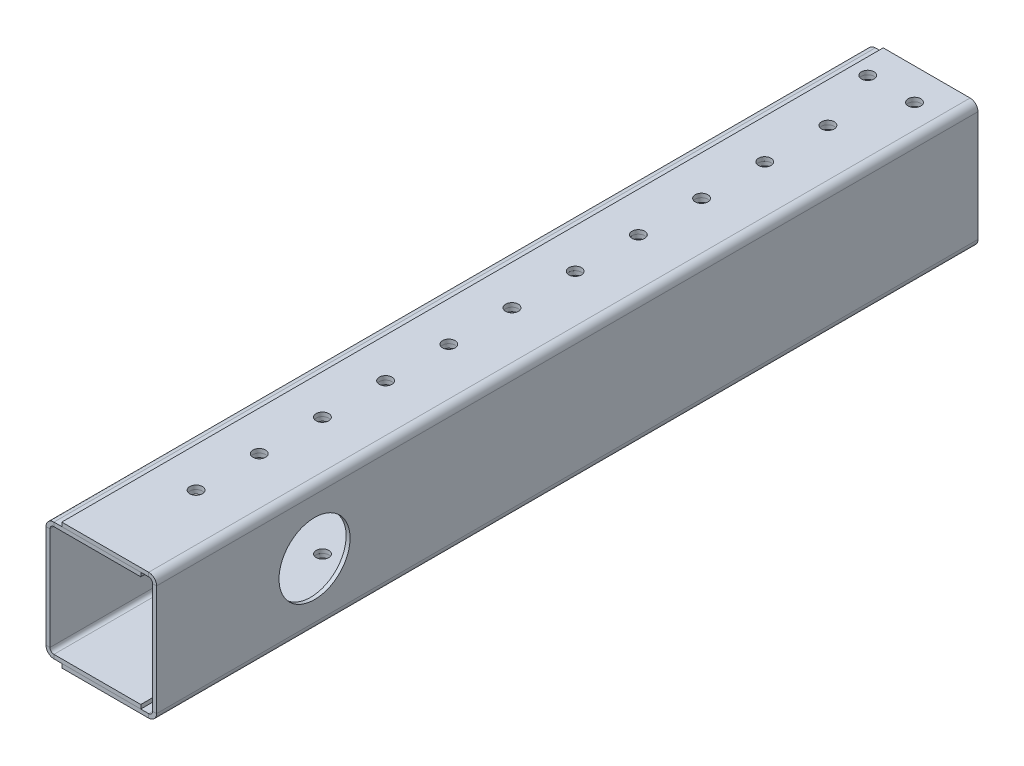
from build123d import *

# Parameters (mm, degrees)
SKETCH1_W                    = 330.2
SKETCH1_H                    = 50.8
SKETCH1_R                    = 14.2875
BOSS_EXTRUDE1_DEPTH          = 1.5875
EDGE_FLANGE1_STRIP_W         = 9.525
EDGE_FLANGE1_STRIP_H         = 1.5875
EDGE_FLANGE1_STRIP_CUT_DEPTH = 330.2
EDGE_FLANGE1_DEPTH           = 330.2
EDGE_FLANGE2_STRIP_W         = 9.525
EDGE_FLANGE2_STRIP_H         = 1.5875
EDGE_FLANGE2_STRIP_CUT_DEPTH = 330.2
EDGE_FLANGE2_DEPTH           = 330.2
SKETCH12_W                   = 330.2
SKETCH12_H                   = 47.625
SKETCH12_R                   = 14.286584365
BOSS_EXTRUDE2_DEPTH          = 1.5875
EDGE_FLANGE3_STRIP_W         = 9.525
EDGE_FLANGE3_STRIP_H         = 1.5875
EDGE_FLANGE3_STRIP_CUT_DEPTH = 330.2
EDGE_FLANGE3_DEPTH           = 330.2
EDGE_FLANGE4_STRIP_W         = 9.525
EDGE_FLANGE4_STRIP_H         = 1.5875
EDGE_FLANGE4_STRIP_CUT_DEPTH = 330.2
EDGE_FLANGE4_DEPTH           = 330.2
SKETCH21_R                   = 2.54
CUT_EXTRUDE1_DEPTH           = 248.894110458
LPATTERN1_COUNT              = 6
LPATTERN1_PITCH              = 25.4
LPATTERN2_COUNT              = 6
LPATTERN2_PITCH              = 25.4
SKETCH27_R                   = 2.54
CUT_EXTRUDE2_DEPTH           = 3.175


# Sheet-metal steps are written as plain solids
with BuildPart() as part:
    # Sketch1 → Boss-Extrude1 (new body)
    with BuildSketch(Plane(origin=(177.8, 0, 0), x_dir=(0, 0, -1), z_dir=(1, 0, 0))):
        Rectangle(SKETCH1_W, SKETCH1_H)
        with Locations((-101.6, 0)):
            Circle(SKETCH1_R, mode=Mode.SUBTRACT)
    extrude(amount=-BOSS_EXTRUDE1_DEPTH)

    # Edge-Flange1 strip (across the edge) → Edge-Flange1 strip cut (cut)
    with BuildSketch(Plane(origin=(176.2125, 25.4, 165.1), x_dir=(0, -1, 0), z_dir=(0, 0, -1))):
        with Locations((-1.5875, -0.79375)):
            Rectangle(EDGE_FLANGE1_STRIP_W, EDGE_FLANGE1_STRIP_H)
    extrude(amount=EDGE_FLANGE1_STRIP_CUT_DEPTH, mode=Mode.SUBTRACT)

    # Edge-Flange1 section (across the edge) → Edge-Flange1 (add)
    with BuildSketch(Plane(origin=(176.2125, 25.4, 165.1), x_dir=(0, -1, 0), z_dir=(0, 0, -1))):
        with BuildLine():
            Line((0, 1.5875), (0, 36.5125))
            Line((0, 36.5125), (1.5875, 36.5125))
            Line((1.5875, 36.5125), (1.5875, 1.5875))
            ThreePointArc((1.5875, 1.5875), (2.052467985, 0.464967985), (3.175, 0))
            Line((3.175, 0), (3.175, -1.5875))
            ThreePointArc((3.175, -1.5875), (0.92993597, -0.65756403), (0, 1.5875))
        make_face()
    extrude(amount=EDGE_FLANGE1_DEPTH)

    # Edge-Flange2 strip (across the edge) → Edge-Flange2 strip cut (cut)
    with BuildSketch(Plane(origin=(176.2125, -25.4, -165.1), x_dir=(0, 1, 0), z_dir=(0, 0, 1))):
        with Locations((-1.5875, -0.79375)):
            Rectangle(EDGE_FLANGE2_STRIP_W, EDGE_FLANGE2_STRIP_H)
    extrude(amount=EDGE_FLANGE2_STRIP_CUT_DEPTH, mode=Mode.SUBTRACT)

    # Edge-Flange2 section (across the edge) → Edge-Flange2 (add)
    with BuildSketch(Plane(origin=(176.2125, -25.4, -165.1), x_dir=(0, 1, 0), z_dir=(0, 0, 1))):
        with BuildLine():
            Line((0, 1.5875), (0, 36.5125))
            Line((0, 36.5125), (1.5875, 36.5125))
            Line((1.5875, 36.5125), (1.5875, 1.5875))
            ThreePointArc((1.5875, 1.5875), (2.052467985, 0.464967985), (3.175, 0))
            Line((3.175, 0), (3.175, -1.5875))
            ThreePointArc((3.175, -1.5875), (0.92993597, -0.65756403), (0, 1.5875))
        make_face()
    extrude(amount=EDGE_FLANGE2_DEPTH)


with BuildPart() as body_2:
    # Sketch12 → Boss-Extrude2 (new body)
    with BuildSketch(Plane(origin=(133.35, 0, 0), x_dir=(0, 0, -1), z_dir=(1, 0, 0))):
        Rectangle(SKETCH12_W, SKETCH12_H)
        with Locations((-101.6, 0)):
            Circle(SKETCH12_R, mode=Mode.SUBTRACT)
    extrude(amount=BOSS_EXTRUDE2_DEPTH)

    # Edge-Flange3 strip (across the edge) → Edge-Flange3 strip cut (cut)
    with BuildSketch(Plane(origin=(134.9375, 23.8125, -165.1), x_dir=(0, -1, 0), z_dir=(0, 0, 1))):
        with Locations((-1.5875, -0.79375)):
            Rectangle(EDGE_FLANGE3_STRIP_W, EDGE_FLANGE3_STRIP_H)
    extrude(amount=EDGE_FLANGE3_STRIP_CUT_DEPTH, mode=Mode.SUBTRACT)

    # Edge-Flange3 section (across the edge) → Edge-Flange3 (add)
    with BuildSketch(Plane(origin=(134.9375, 23.8125, -165.1), x_dir=(0, -1, 0), z_dir=(0, 0, 1))):
        with BuildLine():
            Line((0, 1.5875), (0, 36.5125))
            Line((0, 36.5125), (1.5875, 36.5125))
            Line((1.5875, 36.5125), (1.5875, 1.5875))
            ThreePointArc((1.5875, 1.5875), (2.052467985, 0.464967985), (3.175, 0))
            Line((3.175, 0), (3.175, -1.5875))
            ThreePointArc((3.175, -1.5875), (0.92993597, -0.65756403), (0, 1.5875))
        make_face()
    extrude(amount=EDGE_FLANGE3_DEPTH)

    # Edge-Flange4 strip (across the edge) → Edge-Flange4 strip cut (cut)
    with BuildSketch(Plane(origin=(134.9375, -23.8125, 165.1), x_dir=(0, 1, 0), z_dir=(0, 0, -1))):
        with Locations((-1.5875, -0.79375)):
            Rectangle(EDGE_FLANGE4_STRIP_W, EDGE_FLANGE4_STRIP_H)
    extrude(amount=EDGE_FLANGE4_STRIP_CUT_DEPTH, mode=Mode.SUBTRACT)

    # Edge-Flange4 section (across the edge) → Edge-Flange4 (add)
    with BuildSketch(Plane(origin=(134.9375, -23.8125, 165.1), x_dir=(0, 1, 0), z_dir=(0, 0, -1))):
        with BuildLine():
            Line((0, 1.5875), (0, 36.5125))
            Line((0, 36.5125), (1.5875, 36.5125))
            Line((1.5875, 36.5125), (1.5875, 1.5875))
            ThreePointArc((1.5875, 1.5875), (2.052467985, 0.464967985), (3.175, 0))
            Line((3.175, 0), (3.175, -1.5875))
            ThreePointArc((3.175, -1.5875), (0.92993597, -0.65756403), (0, 1.5875))
        make_face()
    extrude(amount=EDGE_FLANGE4_DEPTH)


with BuildPart() as cut_extrude1_tool:
    # Sketch21 → Cut-Extrude1 (new, through all)
    with BuildSketch(Plane(origin=(0, 25.4, 0), x_dir=(1, 0, 0), z_dir=(0, 1, 0))):
        with Locations(Location((155.575, 0, 0), (0, 0, 180))):
            Circle(SKETCH21_R)
    cut_extrude1 = extrude(amount=-CUT_EXTRUDE1_DEPTH)


with BuildPart() as part_1:
    add(part.part)

    # Cut-Extrude1: cut by cut_extrude1_tool
    add(cut_extrude1_tool.part, mode=Mode.SUBTRACT)


with BuildPart() as body_2_1:
    add(body_2.part)

    # Cut-Extrude1: cut by cut_extrude1_tool
    add(cut_extrude1_tool.part, mode=Mode.SUBTRACT)


with BuildPart() as lpattern1_tool:
    # LPattern1: Cut-Extrude1 ×6
    with Locations(*[(0, 0, i * LPATTERN1_PITCH) for i in range(1, LPATTERN1_COUNT)]):
        add(cut_extrude1)


with BuildPart() as part_2:
    add(part_1.part)

    # LPattern1: cut by lpattern1_tool
    add(lpattern1_tool.part, mode=Mode.SUBTRACT)


with BuildPart() as body_2_2:
    add(body_2_1.part)

    # LPattern1: cut by lpattern1_tool
    add(lpattern1_tool.part, mode=Mode.SUBTRACT)


with BuildPart() as lpattern2_tool:
    # LPattern2: Cut-Extrude1 ×6
    with Locations(*[(0, 0, -i * LPATTERN2_PITCH) for i in range(1, LPATTERN2_COUNT)]):
        add(cut_extrude1)


with BuildPart() as part_3:
    add(part_2.part)

    # LPattern2: cut by lpattern2_tool
    add(lpattern2_tool.part, mode=Mode.SUBTRACT)


with BuildPart() as body_2_3:
    add(body_2_2.part)

    # LPattern2: cut by lpattern2_tool
    add(lpattern2_tool.part, mode=Mode.SUBTRACT)


with BuildPart() as cut_extrude2_tool:
    # Sketch27 → Cut-Extrude2 (new body)
    with BuildSketch(Plane(origin=(0, 25.4, 0), x_dir=(1, 0, 0), z_dir=(0, 1, 0))):
        with Locations(Location((164.973, 152.4, 0), (0, 0, 180))):
            Circle(SKETCH27_R)
        with Locations(Location((146.177, 152.4, 0), (0, 0, 180))):
            Circle(SKETCH27_R)
    extrude(amount=-CUT_EXTRUDE2_DEPTH)


with BuildPart() as part_4:
    add(part_3.part)

    # Cut-Extrude2: cut by cut_extrude2_tool
    add(cut_extrude2_tool.part, mode=Mode.SUBTRACT)


with BuildPart() as body_2_4:
    add(body_2_3.part)

    # Cut-Extrude2: cut by cut_extrude2_tool
    add(cut_extrude2_tool.part, mode=Mode.SUBTRACT)


solid = Compound([part_4.part, body_2_4.part])
